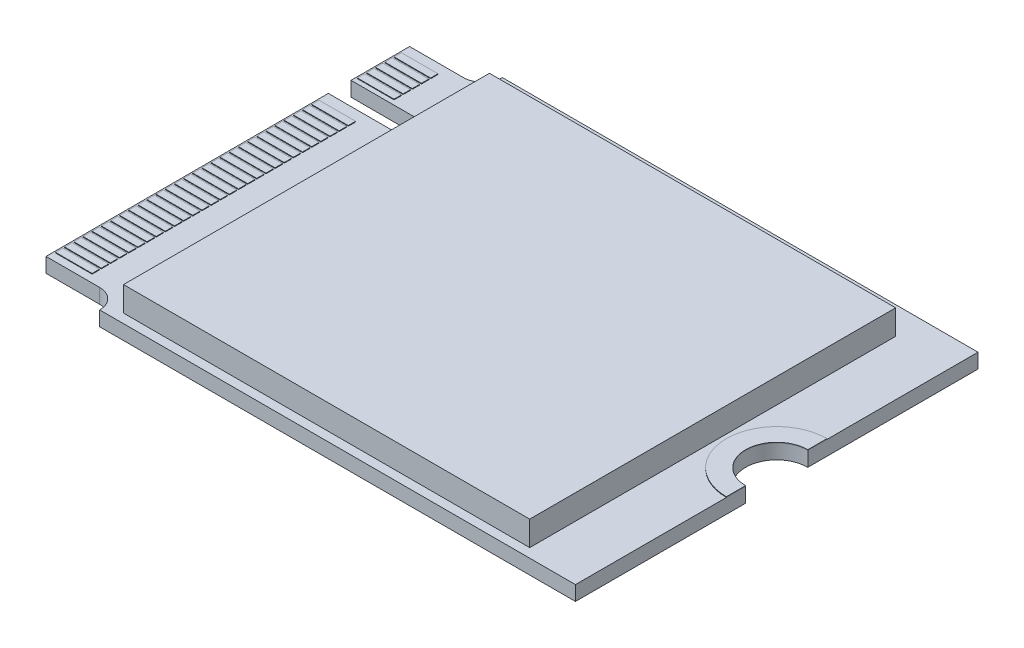
from build123d import *

# Parameters (mm, degrees)
BOSS_EXTRUDE1_DEPTH    = 0.8
SKETCH2_W              = 2
SKETCH2_H              = 0.4
BOSS_EXTRUDE2_DEPTH    = 0.035
BOSS_EXTRUDE2_2_DEPTH  = 0.035
BOSS_EXTRUDE2_3_DEPTH  = 0.035
BOSS_EXTRUDE2_4_DEPTH  = 0.035
BOSS_EXTRUDE2_5_DEPTH  = 0.035
BOSS_EXTRUDE2_6_DEPTH  = 0.035
BOSS_EXTRUDE2_7_DEPTH  = 0.035
BOSS_EXTRUDE2_8_DEPTH  = 0.035
BOSS_EXTRUDE2_9_DEPTH  = 0.035
BOSS_EXTRUDE2_10_DEPTH = 0.035
BOSS_EXTRUDE2_11_DEPTH = 0.035
BOSS_EXTRUDE2_12_DEPTH = 0.035
BOSS_EXTRUDE2_13_DEPTH = 0.035
BOSS_EXTRUDE2_14_DEPTH = 0.035
BOSS_EXTRUDE2_15_DEPTH = 0.035
BOSS_EXTRUDE2_16_DEPTH = 0.035
BOSS_EXTRUDE2_17_DEPTH = 0.035
BOSS_EXTRUDE2_18_DEPTH = 0.035
BOSS_EXTRUDE2_19_DEPTH = 0.035
BOSS_EXTRUDE2_20_DEPTH = 0.035
BOSS_EXTRUDE2_21_DEPTH = 0.035
BOSS_EXTRUDE2_22_DEPTH = 0.035
BOSS_EXTRUDE2_23_DEPTH = 0.035
BOSS_EXTRUDE2_24_DEPTH = 0.035
BOSS_EXTRUDE2_25_DEPTH = 0.035
BOSS_EXTRUDE2_26_DEPTH = 0.035
BOSS_EXTRUDE2_27_DEPTH = 0.035
BOSS_EXTRUDE2_28_DEPTH = 0.035
BOSS_EXTRUDE2_29_DEPTH = 0.035
BOSS_EXTRUDE2_30_DEPTH = 0.035
BOSS_EXTRUDE2_31_DEPTH = 0.035
BOSS_EXTRUDE2_32_DEPTH = 0.035
BOSS_EXTRUDE2_33_DEPTH = 0.035
BOSS_EXTRUDE2_34_DEPTH = 0.035
BOSS_EXTRUDE2_35_DEPTH = 0.035
BOSS_EXTRUDE3_START    = -0.8
SKETCH2_2_W            = 2
SKETCH2_2_H            = 0.4
BOSS_EXTRUDE3_DEPTH    = 0.035
BOSS_EXTRUDE3_2_DEPTH  = 0.035
BOSS_EXTRUDE3_3_DEPTH  = 0.035
BOSS_EXTRUDE3_4_DEPTH  = 0.035
BOSS_EXTRUDE3_5_DEPTH  = 0.035
BOSS_EXTRUDE3_6_DEPTH  = 0.035
BOSS_EXTRUDE3_7_DEPTH  = 0.035
BOSS_EXTRUDE3_8_DEPTH  = 0.035
BOSS_EXTRUDE3_9_DEPTH  = 0.035
BOSS_EXTRUDE3_10_DEPTH = 0.035
BOSS_EXTRUDE3_11_DEPTH = 0.035
BOSS_EXTRUDE3_12_DEPTH = 0.035
BOSS_EXTRUDE3_13_DEPTH = 0.035
BOSS_EXTRUDE3_14_DEPTH = 0.035
BOSS_EXTRUDE3_15_DEPTH = 0.035
BOSS_EXTRUDE3_16_DEPTH = 0.035
BOSS_EXTRUDE3_17_DEPTH = 0.035
BOSS_EXTRUDE3_18_DEPTH = 0.035
BOSS_EXTRUDE3_19_DEPTH = 0.035
BOSS_EXTRUDE3_20_DEPTH = 0.035
BOSS_EXTRUDE3_21_DEPTH = 0.035
BOSS_EXTRUDE3_22_DEPTH = 0.035
BOSS_EXTRUDE3_23_DEPTH = 0.035
BOSS_EXTRUDE3_24_DEPTH = 0.035
BOSS_EXTRUDE3_25_DEPTH = 0.035
BOSS_EXTRUDE3_26_DEPTH = 0.035
BOSS_EXTRUDE3_27_DEPTH = 0.035
BOSS_EXTRUDE3_28_DEPTH = 0.035
BOSS_EXTRUDE3_29_DEPTH = 0.035
SKETCH3_W              = 22.2
SKETCH3_H              = 20
BOSS_EXTRUDE4_DEPTH    = 1.35
SKETCH4_W              = 2
SKETCH4_H              = 0.4
BOSS_EXTRUDE5_DEPTH    = 0.035
BOSS_EXTRUDE5_2_DEPTH  = 0.035
BOSS_EXTRUDE5_3_DEPTH  = 0.035
BOSS_EXTRUDE5_4_DEPTH  = 0.035


with BuildPart() as part:
    # Sketch1 → Boss-Extrude1 (new body)
    with BuildSketch(Plane(origin=(0, 0, 0), x_dir=(1, 0, 0), z_dir=(0, 1, 0))):
        with BuildLine():
            Line((-15, 0), (-15, 5.495))
            Line((-15, 5.495), (-11.6, 5.495))
            ThreePointArc((-11.6, 5.495), (-10.98, 6.115), (-11.6, 6.735))
            Line((-11.6, 6.735), (-15, 6.735))
            Line((-15, 6.735), (-15, 9.935))
            Line((-15, 9.935), (-12.065, 9.935))
            ThreePointArc((-12.065, 9.935), (-11.311931278, 10.246931278), (-11, 11))
            Line((-11, 11), (0, 11))
            Line((0, 11), (15, 11))
            Line((15, 11), (15, 1.7))
            ThreePointArc((15, 1.7), (13.3, 0), (15, -1.7))
            Line((15, -1.7), (15, -11))
            Line((15, -11), (-11, -11))
            ThreePointArc((-11, -11), (-11.311931278, -10.246931278), (-12.065, -9.935))
            Line((-12.065, -9.935), (-15, -9.935))
            Line((-15, -9.935), (-15, 0))
        make_face()
    extrude(amount=BOSS_EXTRUDE1_DEPTH)

    # Sketch3 → Boss-Extrude4 (add)
    with BuildSketch(Plane(origin=(0, 0.8, 0), x_dir=(1, 0, 0), z_dir=(0, 1, 0))):
        with Locations((0.9, -0.5)):
            Rectangle(SKETCH3_W, SKETCH3_H)
    extrude(amount=BOSS_EXTRUDE4_DEPTH)


with BuildPart() as body_2:
    # Sketch2 → Boss-Extrude2 (new body)
    with BuildSketch(Plane(origin=(0, 0.8, 0), x_dir=(1, 0, 0), z_dir=(0, 1, 0))):
        with Locations((-13.9, 9.185)):
            Rectangle(SKETCH2_W, SKETCH2_H)
    extrude(amount=BOSS_EXTRUDE2_DEPTH)


with BuildPart() as body_3:
    # Sketch2 → Boss-Extrude2 2 (new body)
    with BuildSketch(Plane(origin=(0, 0.8, 0), x_dir=(1, 0, 0), z_dir=(0, 1, 0))):
        with Locations((-13.9, 8.685)):
            Rectangle(SKETCH2_W, SKETCH2_H)
    extrude(amount=BOSS_EXTRUDE2_2_DEPTH)


with BuildPart() as body_4:
    # Sketch2 → Boss-Extrude2 3 (new body)
    with BuildSketch(Plane(origin=(0, 0.8, 0), x_dir=(1, 0, 0), z_dir=(0, 1, 0))):
        with Locations((-13.9, 8.185)):
            Rectangle(SKETCH2_W, SKETCH2_H)
    extrude(amount=BOSS_EXTRUDE2_3_DEPTH)


with BuildPart() as body_5:
    # Sketch2 → Boss-Extrude2 4 (new body)
    with BuildSketch(Plane(origin=(0, 0.8, 0), x_dir=(1, 0, 0), z_dir=(0, 1, 0))):
        with Locations((-13.9, 7.685)):
            Rectangle(SKETCH2_W, SKETCH2_H)
    extrude(amount=BOSS_EXTRUDE2_4_DEPTH)


with BuildPart() as body_6:
    # Sketch2 → Boss-Extrude2 5 (new body)
    with BuildSketch(Plane(origin=(0, 0.8, 0), x_dir=(1, 0, 0), z_dir=(0, 1, 0))):
        with Locations((-13.9, 4.685)):
            Rectangle(SKETCH2_W, SKETCH2_H)
    extrude(amount=BOSS_EXTRUDE2_5_DEPTH)


with BuildPart() as body_7:
    # Sketch2 → Boss-Extrude2 6 (new body)
    with BuildSketch(Plane(origin=(0, 0.8, 0), x_dir=(1, 0, 0), z_dir=(0, 1, 0))):
        with Locations((-13.9, 4.185)):
            Rectangle(SKETCH2_W, SKETCH2_H)
    extrude(amount=BOSS_EXTRUDE2_6_DEPTH)


with BuildPart() as body_8:
    # Sketch2 → Boss-Extrude2 7 (new body)
    with BuildSketch(Plane(origin=(0, 0.8, 0), x_dir=(1, 0, 0), z_dir=(0, 1, 0))):
        with Locations((-13.9, 3.685)):
            Rectangle(SKETCH2_W, SKETCH2_H)
    extrude(amount=BOSS_EXTRUDE2_7_DEPTH)


with BuildPart() as body_9:
    # Sketch2 → Boss-Extrude2 8 (new body)
    with BuildSketch(Plane(origin=(0, 0.8, 0), x_dir=(1, 0, 0), z_dir=(0, 1, 0))):
        with Locations((-13.9, 3.185)):
            Rectangle(SKETCH2_W, SKETCH2_H)
    extrude(amount=BOSS_EXTRUDE2_8_DEPTH)


with BuildPart() as body_10:
    # Sketch2 → Boss-Extrude2 9 (new body)
    with BuildSketch(Plane(origin=(0, 0.8, 0), x_dir=(1, 0, 0), z_dir=(0, 1, 0))):
        with Locations((-13.9, 2.685)):
            Rectangle(SKETCH2_W, SKETCH2_H)
    extrude(amount=BOSS_EXTRUDE2_9_DEPTH)


with BuildPart() as body_11:
    # Sketch2 → Boss-Extrude2 10 (new body)
    with BuildSketch(Plane(origin=(0, 0.8, 0), x_dir=(1, 0, 0), z_dir=(0, 1, 0))):
        with Locations((-13.9, 2.185)):
            Rectangle(SKETCH2_W, SKETCH2_H)
    extrude(amount=BOSS_EXTRUDE2_10_DEPTH)


with BuildPart() as body_12:
    # Sketch2 → Boss-Extrude2 11 (new body)
    with BuildSketch(Plane(origin=(0, 0.8, 0), x_dir=(1, 0, 0), z_dir=(0, 1, 0))):
        with Locations((-13.9, 1.685)):
            Rectangle(SKETCH2_W, SKETCH2_H)
    extrude(amount=BOSS_EXTRUDE2_11_DEPTH)


with BuildPart() as body_13:
    # Sketch2 → Boss-Extrude2 12 (new body)
    with BuildSketch(Plane(origin=(0, 0.8, 0), x_dir=(1, 0, 0), z_dir=(0, 1, 0))):
        with Locations((-13.9, 1.185)):
            Rectangle(SKETCH2_W, SKETCH2_H)
    extrude(amount=BOSS_EXTRUDE2_12_DEPTH)


with BuildPart() as body_14:
    # Sketch2 → Boss-Extrude2 13 (new body)
    with BuildSketch(Plane(origin=(0, 0.8, 0), x_dir=(1, 0, 0), z_dir=(0, 1, 0))):
        with Locations((-13.9, 0.685)):
            Rectangle(SKETCH2_W, SKETCH2_H)
    extrude(amount=BOSS_EXTRUDE2_13_DEPTH)


with BuildPart() as body_15:
    # Sketch2 → Boss-Extrude2 14 (new body)
    with BuildSketch(Plane(origin=(0, 0.8, 0), x_dir=(1, 0, 0), z_dir=(0, 1, 0))):
        with Locations((-13.9, 0.185)):
            Rectangle(SKETCH2_W, SKETCH2_H)
    extrude(amount=BOSS_EXTRUDE2_14_DEPTH)


with BuildPart() as body_16:
    # Sketch2 → Boss-Extrude2 15 (new body)
    with BuildSketch(Plane(origin=(0, 0.8, 0), x_dir=(1, 0, 0), z_dir=(0, 1, 0))):
        with Locations((-13.9, -0.315)):
            Rectangle(SKETCH2_W, SKETCH2_H)
    extrude(amount=BOSS_EXTRUDE2_15_DEPTH)


with BuildPart() as body_17:
    # Sketch2 → Boss-Extrude2 16 (new body)
    with BuildSketch(Plane(origin=(0, 0.8, 0), x_dir=(1, 0, 0), z_dir=(0, 1, 0))):
        with Locations((-13.9, -0.815)):
            Rectangle(SKETCH2_W, SKETCH2_H)
    extrude(amount=BOSS_EXTRUDE2_16_DEPTH)


with BuildPart() as body_18:
    # Sketch2 → Boss-Extrude2 17 (new body)
    with BuildSketch(Plane(origin=(0, 0.8, 0), x_dir=(1, 0, 0), z_dir=(0, 1, 0))):
        with Locations((-13.9, -1.315)):
            Rectangle(SKETCH2_W, SKETCH2_H)
    extrude(amount=BOSS_EXTRUDE2_17_DEPTH)


with BuildPart() as body_19:
    # Sketch2 → Boss-Extrude2 18 (new body)
    with BuildSketch(Plane(origin=(0, 0.8, 0), x_dir=(1, 0, 0), z_dir=(0, 1, 0))):
        with Locations((-13.9, -1.815)):
            Rectangle(SKETCH2_W, SKETCH2_H)
    extrude(amount=BOSS_EXTRUDE2_18_DEPTH)


with BuildPart() as body_20:
    # Sketch2 → Boss-Extrude2 19 (new body)
    with BuildSketch(Plane(origin=(0, 0.8, 0), x_dir=(1, 0, 0), z_dir=(0, 1, 0))):
        with Locations((-13.9, -2.315)):
            Rectangle(SKETCH2_W, SKETCH2_H)
    extrude(amount=BOSS_EXTRUDE2_19_DEPTH)


with BuildPart() as body_21:
    # Sketch2 → Boss-Extrude2 20 (new body)
    with BuildSketch(Plane(origin=(0, 0.8, 0), x_dir=(1, 0, 0), z_dir=(0, 1, 0))):
        with Locations((-13.9, -2.815)):
            Rectangle(SKETCH2_W, SKETCH2_H)
    extrude(amount=BOSS_EXTRUDE2_20_DEPTH)


with BuildPart() as body_22:
    # Sketch2 → Boss-Extrude2 21 (new body)
    with BuildSketch(Plane(origin=(0, 0.8, 0), x_dir=(1, 0, 0), z_dir=(0, 1, 0))):
        with Locations((-13.9, -3.315)):
            Rectangle(SKETCH2_W, SKETCH2_H)
    extrude(amount=BOSS_EXTRUDE2_21_DEPTH)


with BuildPart() as body_23:
    # Sketch2 → Boss-Extrude2 22 (new body)
    with BuildSketch(Plane(origin=(0, 0.8, 0), x_dir=(1, 0, 0), z_dir=(0, 1, 0))):
        with Locations((-13.9, -3.815)):
            Rectangle(SKETCH2_W, SKETCH2_H)
    extrude(amount=BOSS_EXTRUDE2_22_DEPTH)


with BuildPart() as body_24:
    # Sketch2 → Boss-Extrude2 23 (new body)
    with BuildSketch(Plane(origin=(0, 0.8, 0), x_dir=(1, 0, 0), z_dir=(0, 1, 0))):
        with Locations((-13.9, -4.315)):
            Rectangle(SKETCH2_W, SKETCH2_H)
    extrude(amount=BOSS_EXTRUDE2_23_DEPTH)


with BuildPart() as body_25:
    # Sketch2 → Boss-Extrude2 24 (new body)
    with BuildSketch(Plane(origin=(0, 0.8, 0), x_dir=(1, 0, 0), z_dir=(0, 1, 0))):
        with Locations((-13.9, -4.815)):
            Rectangle(SKETCH2_W, SKETCH2_H)
    extrude(amount=BOSS_EXTRUDE2_24_DEPTH)


with BuildPart() as body_26:
    # Sketch2 → Boss-Extrude2 25 (new body)
    with BuildSketch(Plane(origin=(0, 0.8, 0), x_dir=(1, 0, 0), z_dir=(0, 1, 0))):
        with Locations((-13.9, -5.315)):
            Rectangle(SKETCH2_W, SKETCH2_H)
    extrude(amount=BOSS_EXTRUDE2_25_DEPTH)


with BuildPart() as body_27:
    # Sketch2 → Boss-Extrude2 26 (new body)
    with BuildSketch(Plane(origin=(0, 0.8, 0), x_dir=(1, 0, 0), z_dir=(0, 1, 0))):
        with Locations((-13.9, -5.815)):
            Rectangle(SKETCH2_W, SKETCH2_H)
    extrude(amount=BOSS_EXTRUDE2_26_DEPTH)


with BuildPart() as body_28:
    # Sketch2 → Boss-Extrude2 27 (new body)
    with BuildSketch(Plane(origin=(0, 0.8, 0), x_dir=(1, 0, 0), z_dir=(0, 1, 0))):
        with Locations((-13.9, -6.315)):
            Rectangle(SKETCH2_W, SKETCH2_H)
    extrude(amount=BOSS_EXTRUDE2_27_DEPTH)


with BuildPart() as body_29:
    # Sketch2 → Boss-Extrude2 28 (new body)
    with BuildSketch(Plane(origin=(0, 0.8, 0), x_dir=(1, 0, 0), z_dir=(0, 1, 0))):
        with Locations((-13.9, -6.815)):
            Rectangle(SKETCH2_W, SKETCH2_H)
    extrude(amount=BOSS_EXTRUDE2_28_DEPTH)


with BuildPart() as body_30:
    # Sketch2 → Boss-Extrude2 29 (new body)
    with BuildSketch(Plane(origin=(0, 0.8, 0), x_dir=(1, 0, 0), z_dir=(0, 1, 0))):
        with Locations((-13.9, -7.315)):
            Rectangle(SKETCH2_W, SKETCH2_H)
    extrude(amount=BOSS_EXTRUDE2_29_DEPTH)


with BuildPart() as body_31:
    # Sketch2 → Boss-Extrude2 30 (new body)
    with BuildSketch(Plane(origin=(0, 0.8, 0), x_dir=(1, 0, 0), z_dir=(0, 1, 0))):
        with Locations((-13.9, -7.815)):
            Rectangle(SKETCH2_W, SKETCH2_H)
    extrude(amount=BOSS_EXTRUDE2_30_DEPTH)


with BuildPart() as body_32:
    # Sketch2 → Boss-Extrude2 31 (new body)
    with BuildSketch(Plane(origin=(0, 0.8, 0), x_dir=(1, 0, 0), z_dir=(0, 1, 0))):
        with Locations((-13.9, -8.315)):
            Rectangle(SKETCH2_W, SKETCH2_H)
    extrude(amount=BOSS_EXTRUDE2_31_DEPTH)


with BuildPart() as body_33:
    # Sketch2 → Boss-Extrude2 32 (new body)
    with BuildSketch(Plane(origin=(0, 0.8, 0), x_dir=(1, 0, 0), z_dir=(0, 1, 0))):
        with Locations((-13.9, -8.815)):
            Rectangle(SKETCH2_W, SKETCH2_H)
    extrude(amount=BOSS_EXTRUDE2_32_DEPTH)


with BuildPart() as body_34:
    # Sketch2 → Boss-Extrude2 33 (new body)
    with BuildSketch(Plane(origin=(0, 0.8, 0), x_dir=(1, 0, 0), z_dir=(0, 1, 0))):
        with Locations((-13.9, -9.315)):
            Rectangle(SKETCH2_W, SKETCH2_H)
    extrude(amount=BOSS_EXTRUDE2_33_DEPTH)


with BuildPart() as body_35:
    # Sketch2 → Boss-Extrude2 34 (new body)
    with BuildSketch(Plane(origin=(0, 0.8, 0), x_dir=(1, 0, 0), z_dir=(0, 1, 0))):
        with Locations((-13.9, 7.185)):
            Rectangle(SKETCH2_W, SKETCH2_H)
    extrude(amount=BOSS_EXTRUDE2_34_DEPTH)


with BuildPart() as body_36:
    # Sketch2 → Boss-Extrude2 35 (new body)
    with BuildSketch(Plane(origin=(0, 0.8, 0), x_dir=(1, 0, 0), z_dir=(0, 1, 0))):
        with BuildLine():
            Line((15, 1.7), (15, 2.75))
            ThreePointArc((15, 2.75), (12.25, 0), (15, -2.75))
            Line((15, -2.75), (15, -1.7))
            ThreePointArc((15, -1.7), (13.3, 0), (15, 1.7))
        make_face()
    extrude(amount=BOSS_EXTRUDE2_35_DEPTH)


with BuildPart() as body_37:
    # Sketch2<2> → Boss-Extrude3 (new body)
    with BuildSketch(Plane(origin=(0, 0.8, 0), x_dir=(1, 0, 0), z_dir=(0, 1, 0)).offset(BOSS_EXTRUDE3_START)):
        with Locations((-13.9, 4.685)):
            Rectangle(SKETCH2_2_W, SKETCH2_2_H)
    extrude(amount=-BOSS_EXTRUDE3_DEPTH)


with BuildPart() as body_38:
    # Sketch2<2> → Boss-Extrude3 2 (new body)
    with BuildSketch(Plane(origin=(0, 0.8, 0), x_dir=(1, 0, 0), z_dir=(0, 1, 0)).offset(BOSS_EXTRUDE3_START)):
        with Locations((-13.9, 4.185)):
            Rectangle(SKETCH2_2_W, SKETCH2_2_H)
    extrude(amount=-BOSS_EXTRUDE3_2_DEPTH)


with BuildPart() as body_39:
    # Sketch2<2> → Boss-Extrude3 3 (new body)
    with BuildSketch(Plane(origin=(0, 0.8, 0), x_dir=(1, 0, 0), z_dir=(0, 1, 0)).offset(BOSS_EXTRUDE3_START)):
        with Locations((-13.9, 3.685)):
            Rectangle(SKETCH2_2_W, SKETCH2_2_H)
    extrude(amount=-BOSS_EXTRUDE3_3_DEPTH)


with BuildPart() as body_40:
    # Sketch2<2> → Boss-Extrude3 4 (new body)
    with BuildSketch(Plane(origin=(0, 0.8, 0), x_dir=(1, 0, 0), z_dir=(0, 1, 0)).offset(BOSS_EXTRUDE3_START)):
        with Locations((-13.9, 3.185)):
            Rectangle(SKETCH2_2_W, SKETCH2_2_H)
    extrude(amount=-BOSS_EXTRUDE3_4_DEPTH)


with BuildPart() as body_41:
    # Sketch2<2> → Boss-Extrude3 5 (new body)
    with BuildSketch(Plane(origin=(0, 0.8, 0), x_dir=(1, 0, 0), z_dir=(0, 1, 0)).offset(BOSS_EXTRUDE3_START)):
        with Locations((-13.9, 2.685)):
            Rectangle(SKETCH2_2_W, SKETCH2_2_H)
    extrude(amount=-BOSS_EXTRUDE3_5_DEPTH)


with BuildPart() as body_42:
    # Sketch2<2> → Boss-Extrude3 6 (new body)
    with BuildSketch(Plane(origin=(0, 0.8, 0), x_dir=(1, 0, 0), z_dir=(0, 1, 0)).offset(BOSS_EXTRUDE3_START)):
        with Locations((-13.9, 2.185)):
            Rectangle(SKETCH2_2_W, SKETCH2_2_H)
    extrude(amount=-BOSS_EXTRUDE3_6_DEPTH)


with BuildPart() as body_43:
    # Sketch2<2> → Boss-Extrude3 7 (new body)
    with BuildSketch(Plane(origin=(0, 0.8, 0), x_dir=(1, 0, 0), z_dir=(0, 1, 0)).offset(BOSS_EXTRUDE3_START)):
        with Locations((-13.9, 1.685)):
            Rectangle(SKETCH2_2_W, SKETCH2_2_H)
    extrude(amount=-BOSS_EXTRUDE3_7_DEPTH)


with BuildPart() as body_44:
    # Sketch2<2> → Boss-Extrude3 8 (new body)
    with BuildSketch(Plane(origin=(0, 0.8, 0), x_dir=(1, 0, 0), z_dir=(0, 1, 0)).offset(BOSS_EXTRUDE3_START)):
        with Locations((-13.9, 1.185)):
            Rectangle(SKETCH2_2_W, SKETCH2_2_H)
    extrude(amount=-BOSS_EXTRUDE3_8_DEPTH)


with BuildPart() as body_45:
    # Sketch2<2> → Boss-Extrude3 9 (new body)
    with BuildSketch(Plane(origin=(0, 0.8, 0), x_dir=(1, 0, 0), z_dir=(0, 1, 0)).offset(BOSS_EXTRUDE3_START)):
        with Locations((-13.9, 0.685)):
            Rectangle(SKETCH2_2_W, SKETCH2_2_H)
    extrude(amount=-BOSS_EXTRUDE3_9_DEPTH)


with BuildPart() as body_46:
    # Sketch2<2> → Boss-Extrude3 10 (new body)
    with BuildSketch(Plane(origin=(0, 0.8, 0), x_dir=(1, 0, 0), z_dir=(0, 1, 0)).offset(BOSS_EXTRUDE3_START)):
        with Locations((-13.9, 0.185)):
            Rectangle(SKETCH2_2_W, SKETCH2_2_H)
    extrude(amount=-BOSS_EXTRUDE3_10_DEPTH)


with BuildPart() as body_47:
    # Sketch2<2> → Boss-Extrude3 11 (new body)
    with BuildSketch(Plane(origin=(0, 0.8, 0), x_dir=(1, 0, 0), z_dir=(0, 1, 0)).offset(BOSS_EXTRUDE3_START)):
        with Locations((-13.9, -0.315)):
            Rectangle(SKETCH2_2_W, SKETCH2_2_H)
    extrude(amount=-BOSS_EXTRUDE3_11_DEPTH)


with BuildPart() as body_48:
    # Sketch2<2> → Boss-Extrude3 12 (new body)
    with BuildSketch(Plane(origin=(0, 0.8, 0), x_dir=(1, 0, 0), z_dir=(0, 1, 0)).offset(BOSS_EXTRUDE3_START)):
        with Locations((-13.9, -0.815)):
            Rectangle(SKETCH2_2_W, SKETCH2_2_H)
    extrude(amount=-BOSS_EXTRUDE3_12_DEPTH)


with BuildPart() as body_49:
    # Sketch2<2> → Boss-Extrude3 13 (new body)
    with BuildSketch(Plane(origin=(0, 0.8, 0), x_dir=(1, 0, 0), z_dir=(0, 1, 0)).offset(BOSS_EXTRUDE3_START)):
        with Locations((-13.9, -1.315)):
            Rectangle(SKETCH2_2_W, SKETCH2_2_H)
    extrude(amount=-BOSS_EXTRUDE3_13_DEPTH)


with BuildPart() as body_50:
    # Sketch2<2> → Boss-Extrude3 14 (new body)
    with BuildSketch(Plane(origin=(0, 0.8, 0), x_dir=(1, 0, 0), z_dir=(0, 1, 0)).offset(BOSS_EXTRUDE3_START)):
        with Locations((-13.9, -1.815)):
            Rectangle(SKETCH2_2_W, SKETCH2_2_H)
    extrude(amount=-BOSS_EXTRUDE3_14_DEPTH)


with BuildPart() as body_51:
    # Sketch2<2> → Boss-Extrude3 15 (new body)
    with BuildSketch(Plane(origin=(0, 0.8, 0), x_dir=(1, 0, 0), z_dir=(0, 1, 0)).offset(BOSS_EXTRUDE3_START)):
        with Locations((-13.9, -2.315)):
            Rectangle(SKETCH2_2_W, SKETCH2_2_H)
    extrude(amount=-BOSS_EXTRUDE3_15_DEPTH)


with BuildPart() as body_52:
    # Sketch2<2> → Boss-Extrude3 16 (new body)
    with BuildSketch(Plane(origin=(0, 0.8, 0), x_dir=(1, 0, 0), z_dir=(0, 1, 0)).offset(BOSS_EXTRUDE3_START)):
        with Locations((-13.9, -2.815)):
            Rectangle(SKETCH2_2_W, SKETCH2_2_H)
    extrude(amount=-BOSS_EXTRUDE3_16_DEPTH)


with BuildPart() as body_53:
    # Sketch2<2> → Boss-Extrude3 17 (new body)
    with BuildSketch(Plane(origin=(0, 0.8, 0), x_dir=(1, 0, 0), z_dir=(0, 1, 0)).offset(BOSS_EXTRUDE3_START)):
        with Locations((-13.9, -3.315)):
            Rectangle(SKETCH2_2_W, SKETCH2_2_H)
    extrude(amount=-BOSS_EXTRUDE3_17_DEPTH)


with BuildPart() as body_54:
    # Sketch2<2> → Boss-Extrude3 18 (new body)
    with BuildSketch(Plane(origin=(0, 0.8, 0), x_dir=(1, 0, 0), z_dir=(0, 1, 0)).offset(BOSS_EXTRUDE3_START)):
        with Locations((-13.9, -3.815)):
            Rectangle(SKETCH2_2_W, SKETCH2_2_H)
    extrude(amount=-BOSS_EXTRUDE3_18_DEPTH)


with BuildPart() as body_55:
    # Sketch2<2> → Boss-Extrude3 19 (new body)
    with BuildSketch(Plane(origin=(0, 0.8, 0), x_dir=(1, 0, 0), z_dir=(0, 1, 0)).offset(BOSS_EXTRUDE3_START)):
        with Locations((-13.9, -4.315)):
            Rectangle(SKETCH2_2_W, SKETCH2_2_H)
    extrude(amount=-BOSS_EXTRUDE3_19_DEPTH)


with BuildPart() as body_56:
    # Sketch2<2> → Boss-Extrude3 20 (new body)
    with BuildSketch(Plane(origin=(0, 0.8, 0), x_dir=(1, 0, 0), z_dir=(0, 1, 0)).offset(BOSS_EXTRUDE3_START)):
        with Locations((-13.9, -4.815)):
            Rectangle(SKETCH2_2_W, SKETCH2_2_H)
    extrude(amount=-BOSS_EXTRUDE3_20_DEPTH)


with BuildPart() as body_57:
    # Sketch2<2> → Boss-Extrude3 21 (new body)
    with BuildSketch(Plane(origin=(0, 0.8, 0), x_dir=(1, 0, 0), z_dir=(0, 1, 0)).offset(BOSS_EXTRUDE3_START)):
        with Locations((-13.9, -5.315)):
            Rectangle(SKETCH2_2_W, SKETCH2_2_H)
    extrude(amount=-BOSS_EXTRUDE3_21_DEPTH)


with BuildPart() as body_58:
    # Sketch2<2> → Boss-Extrude3 22 (new body)
    with BuildSketch(Plane(origin=(0, 0.8, 0), x_dir=(1, 0, 0), z_dir=(0, 1, 0)).offset(BOSS_EXTRUDE3_START)):
        with Locations((-13.9, -5.815)):
            Rectangle(SKETCH2_2_W, SKETCH2_2_H)
    extrude(amount=-BOSS_EXTRUDE3_22_DEPTH)


with BuildPart() as body_59:
    # Sketch2<2> → Boss-Extrude3 23 (new body)
    with BuildSketch(Plane(origin=(0, 0.8, 0), x_dir=(1, 0, 0), z_dir=(0, 1, 0)).offset(BOSS_EXTRUDE3_START)):
        with Locations((-13.9, -6.315)):
            Rectangle(SKETCH2_2_W, SKETCH2_2_H)
    extrude(amount=-BOSS_EXTRUDE3_23_DEPTH)


with BuildPart() as body_60:
    # Sketch2<2> → Boss-Extrude3 24 (new body)
    with BuildSketch(Plane(origin=(0, 0.8, 0), x_dir=(1, 0, 0), z_dir=(0, 1, 0)).offset(BOSS_EXTRUDE3_START)):
        with Locations((-13.9, -6.815)):
            Rectangle(SKETCH2_2_W, SKETCH2_2_H)
    extrude(amount=-BOSS_EXTRUDE3_24_DEPTH)


with BuildPart() as body_61:
    # Sketch2<2> → Boss-Extrude3 25 (new body)
    with BuildSketch(Plane(origin=(0, 0.8, 0), x_dir=(1, 0, 0), z_dir=(0, 1, 0)).offset(BOSS_EXTRUDE3_START)):
        with Locations((-13.9, -7.315)):
            Rectangle(SKETCH2_2_W, SKETCH2_2_H)
    extrude(amount=-BOSS_EXTRUDE3_25_DEPTH)


with BuildPart() as body_62:
    # Sketch2<2> → Boss-Extrude3 26 (new body)
    with BuildSketch(Plane(origin=(0, 0.8, 0), x_dir=(1, 0, 0), z_dir=(0, 1, 0)).offset(BOSS_EXTRUDE3_START)):
        with Locations((-13.9, -7.815)):
            Rectangle(SKETCH2_2_W, SKETCH2_2_H)
    extrude(amount=-BOSS_EXTRUDE3_26_DEPTH)


with BuildPart() as body_63:
    # Sketch2<2> → Boss-Extrude3 27 (new body)
    with BuildSketch(Plane(origin=(0, 0.8, 0), x_dir=(1, 0, 0), z_dir=(0, 1, 0)).offset(BOSS_EXTRUDE3_START)):
        with Locations((-13.9, -8.315)):
            Rectangle(SKETCH2_2_W, SKETCH2_2_H)
    extrude(amount=-BOSS_EXTRUDE3_27_DEPTH)


with BuildPart() as body_64:
    # Sketch2<2> → Boss-Extrude3 28 (new body)
    with BuildSketch(Plane(origin=(0, 0.8, 0), x_dir=(1, 0, 0), z_dir=(0, 1, 0)).offset(BOSS_EXTRUDE3_START)):
        with Locations((-13.9, -8.815)):
            Rectangle(SKETCH2_2_W, SKETCH2_2_H)
    extrude(amount=-BOSS_EXTRUDE3_28_DEPTH)


with BuildPart() as body_65:
    # Sketch2<2> → Boss-Extrude3 29 (new body)
    with BuildSketch(Plane(origin=(0, 0.8, 0), x_dir=(1, 0, 0), z_dir=(0, 1, 0)).offset(BOSS_EXTRUDE3_START)):
        with Locations((-13.9, -9.315)):
            Rectangle(SKETCH2_2_W, SKETCH2_2_H)
    extrude(amount=-BOSS_EXTRUDE3_29_DEPTH)


with BuildPart() as body_66:
    # Sketch4 → Boss-Extrude5 (new body)
    with BuildSketch(Plane.XZ):
        with Locations((-13.9, -7.435)):
            Rectangle(SKETCH4_W, SKETCH4_H)
    extrude(amount=BOSS_EXTRUDE5_DEPTH)


with BuildPart() as body_67:
    # Sketch4 → Boss-Extrude5 2 (new body)
    with BuildSketch(Plane.XZ):
        with Locations((-13.9, -7.935)):
            Rectangle(SKETCH4_W, SKETCH4_H)
    extrude(amount=BOSS_EXTRUDE5_2_DEPTH)


with BuildPart() as body_68:
    # Sketch4 → Boss-Extrude5 3 (new body)
    with BuildSketch(Plane.XZ):
        with Locations((-13.9, -8.435)):
            Rectangle(SKETCH4_W, SKETCH4_H)
    extrude(amount=BOSS_EXTRUDE5_3_DEPTH)


with BuildPart() as body_69:
    # Sketch4 → Boss-Extrude5 4 (new body)
    with BuildSketch(Plane.XZ):
        with Locations((-13.9, -8.935)):
            Rectangle(SKETCH4_W, SKETCH4_H)
    extrude(amount=BOSS_EXTRUDE5_4_DEPTH)


solid = Compound([part.part, body_2.part, body_3.part, body_4.part, body_5.part, body_6.part, body_7.part, body_8.part, body_9.part, body_10.part, body_11.part, body_12.part, body_13.part, body_14.part, body_15.part, body_16.part, body_17.part, body_18.part, body_19.part, body_20.part, body_21.part, body_22.part, body_23.part, body_24.part, body_25.part, body_26.part, body_27.part, body_28.part, body_29.part, body_30.part, body_31.part, body_32.part, body_33.part, body_34.part, body_35.part, body_36.part, body_37.part, body_38.part, body_39.part, body_40.part, body_41.part, body_42.part, body_43.part, body_44.part, body_45.part, body_46.part, body_47.part, body_48.part, body_49.part, body_50.part, body_51.part, body_52.part, body_53.part, body_54.part, body_55.part, body_56.part, body_57.part, body_58.part, body_59.part, body_60.part, body_61.part, body_62.part, body_63.part, body_64.part, body_65.part, body_66.part, body_67.part, body_68.part, body_69.part])
